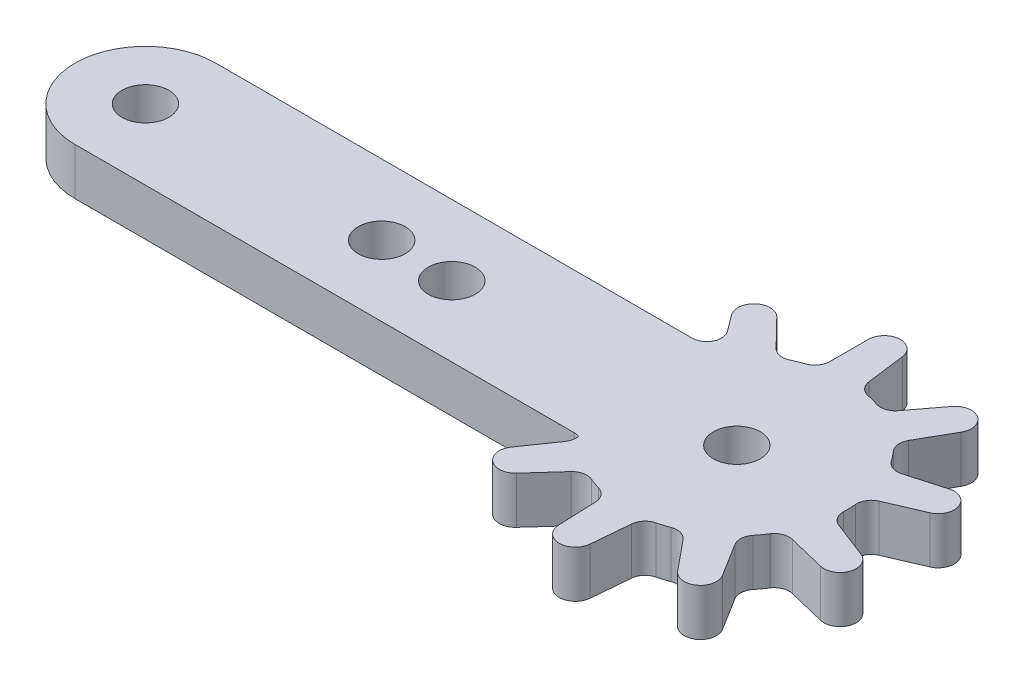
from build123d import *

# Parameters (mm, degrees)
CROQUIS1_R              = 1.5875
SALIENTE_EXTRUIR1_DEPTH = 3.175
SALIENTE_EXTRUIR2_START = -3.175
CROQUIS2_R              = 7.5
CROQUIS2_R_2            = 1.5875
SALIENTE_EXTRUIR2_DEPTH = 3.175
SALIENTE_EXTRUIR3_START = -3.175
SALIENTE_EXTRUIR3_DEPTH = 3.175
CORTAR_EXTRUIR4_START   = -10
CORTAR_EXTRUIR4_DEPTH   = 10
MATRIZC1_COUNT          = 8
MATRIZC1_ANGLE          = 259
REDONDEO1_R             = 1
ESQUISSE1_R             = 1.59
ENL_V_MAT_EXTRU_1_DEPTH = 36.494905734


with BuildPart() as part:
    # Croquis1 → Saliente-Extruir1 (new body)
    with BuildSketch(Plane(origin=(0, 0, 0), x_dir=(1, 0, 0), z_dir=(0, 1, 0))):
        with BuildLine():
            Line((-20, 0), (20, 0))
            ThreePointArc((20, 0), (24.7625, -4.7625), (20, -9.525))
            Line((20, -9.525), (-20, -9.525))
            ThreePointArc((-20, -9.525), (-24.7625, -4.7625), (-20, 0))
        make_face()
        with Locations(Location((-20, -4.7625, 0), (0, 0, 270))):
            Circle(CROQUIS1_R, mode=Mode.SUBTRACT)
        with Locations(Location((20, -4.7625, 0), (0, 0, 270))):
            Circle(CROQUIS1_R, mode=Mode.SUBTRACT)
    extrude(amount=SALIENTE_EXTRUIR1_DEPTH)

    # Croquis2 → Saliente-Extruir2 (add)
    with BuildSketch(Plane(origin=(0, 3.175, 0), x_dir=(1, 0, 0), z_dir=(0, 1, 0)).offset(SALIENTE_EXTRUIR2_START)):
        with Locations((20, -4.7625)):
            Circle(CROQUIS2_R)
        with Locations(Location((20, -4.7625, 0), (0, 0, 270))):
            Circle(CROQUIS2_R_2, mode=Mode.SUBTRACT)
    extrude(amount=SALIENTE_EXTRUIR2_DEPTH)

    # Croquis8 → Saliente-Extruir3 (add)
    with BuildSketch(Plane(origin=(0, 3.175, 0), x_dir=(1, 0, 0), z_dir=(0, 1, 0)).offset(SALIENTE_EXTRUIR3_START)):
        with BuildLine():
            Line((11.607813982, 3.461471902), (14.206158981, 0))
            ThreePointArc((14.206158981, 0), (15.121179891, 0.933736858), (16.184441281, 1.694396442))
            Line((16.184441281, 1.694396442), (13.163387879, 4.793819098))
            ThreePointArc((13.163387879, 4.793819098), (12.356515163, 4.161604411), (11.607813982, 3.461471902))
        make_face()
    saliente_extruir3 = extrude(amount=SALIENTE_EXTRUIR3_DEPTH)

    # Croquis9 → Cortar-Extruir4 (cut)
    with BuildSketch(Plane(origin=(0, 3.175, 0), x_dir=(1, 0, 0), z_dir=(0, 1, 0)).offset(CORTAR_EXTRUIR4_START)):
        with BuildLine():
            ThreePointArc((12.35651523, 4.161604469), (11.974526132, 3.819706546), (11.607813982, 3.461471902))
            Line((11.607813982, 3.461471902), (12.19397403, 2.680599255))
            ThreePointArc((12.19397403, 2.680599255), (11.982381708, 3.453243741), (12.35651523, 4.161604469))
        make_face()
        with BuildLine():
            ThreePointArc((13.163387879, 4.793819098), (12.753054069, 4.486514795), (12.35651523, 4.161604469))
            ThreePointArc((12.35651523, 4.161604469), (13.113956627, 4.422436237), (13.844906618, 4.094621057))
            Line((13.844906618, 4.094621057), (13.163387879, 4.793819098))
        make_face()
    cortar_extruir4 = extrude(amount=CORTAR_EXTRUIR4_DEPTH, mode=Mode.SUBTRACT)

    # MatrizC1: Saliente-Extruir3, Cortar-Extruir4 ×8 about axis
    matrizc1_axis = Axis((20, 0, 4.7625), (0, -1, 0))
    add([saliente_extruir3.rotate(matrizc1_axis, i * MATRIZC1_ANGLE / (MATRIZC1_COUNT - 1)) for i in range(1, MATRIZC1_COUNT)])
    add([cortar_extruir4.rotate(matrizc1_axis, i * MATRIZC1_ANGLE / (MATRIZC1_COUNT - 1)) for i in range(1, MATRIZC1_COUNT)], mode=Mode.SUBTRACT)

    # Redondeo1
    # the kernel refuses this fillet: 1 mm, written as the material it adds along each edge
    with BuildSketch(Plane(origin=(27.395406089, 0, 3.514313802), x_dir=(0.12009264391370789, 0, 0.9927626891044079), z_dir=(0, 1, 0)), Plane(origin=(26.657411119, 0, 8.216320666), x_dir=(-0.501549250802915, 0, 0.8651290938461349), z_dir=(0, 1, 0)), Plane(origin=(23.238283761, 0, 11.527373856), x_dir=(-0.9212027273713431, 0, 0.389082941136718), z_dir=(0, 1, 0)), Plane(origin=(18.515005687, 0, 12.114016299), x_dir=(-0.9698611692594302, 0, -0.243658187555294), z_dir=(0, 1, 0)), Plane(origin=(14.389777858, 0, 9.739990082), x_dir=(-0.6279284118017822, 0, -0.7782711029275668), z_dir=(0, 1, 0)), Plane(origin=(16.184441281, 0, -1.694396442), x_dir=(0.8837864601497757, 0, -0.4678904710035554), z_dir=(0, 1, 0)), Plane(origin=(20.838616598, 0, -2.690467342), x_dir=(0.9874067650142349, 0, 0.15820202402031353), z_dir=(0, 1, 0)), Plane(origin=(25.155056708, 0, -0.685012307), x_dir=(0.6933697506528057, 0, 0.7205819792915072), z_dir=(0, 1, 0))) as redondeo1_piece_1:
        with BuildLine():
            CenterArc((0.748840141, 0.998904162), REDONDEO1_R, 196.368950511, 70.948483307)
            Line((-0.210626698, 0.717082614), (0, 0))
            ThreePointArc((0, 0), (0.351018816, 0.008218784), (0.702037632, 0))
        make_face()
    extrude(amount=3.175)
    with BuildSketch(Plane(origin=(26.522503707, 0, 1.06021079), x_dir=(0.9617717559465732, 0, -0.2738523132336944), z_dir=(0, 1, 0)), Plane(origin=(27.437196341, 0, 5.731061088), x_dir=(0.9329135130884484, 0, 0.36010050971495355), z_dir=(0, 1, 0)), Plane(origin=(25.35671448, 0, 10.011843767), x_dir=(0.5283439627642348, 0, 0.8490304217226758), z_dir=(0, 1, 0)), Plane(origin=(21.11892846, 0, 12.178563585), x_dir=(-0.0890050127232042, 0, 0.9960311780813601), z_dir=(0, 1, 0)), Plane(origin=(16.430517523, 0, 11.358619681), x_dir=(-0.6705090902301596, 0, 0.7419013141373477), z_dir=(0, 1, 0)), Plane(origin=(18.238976871, 0, -2.527822183), x_dir=(0.0018564846529317855, 0, -0.9999982767308818), z_dir=(0, 1, 0)), Plane(origin=(22.981009808, 0, -2.119620351), x_dir=(0.6032966406304949, 0, -0.7975168734289948), z_dir=(0, 1, 0))) as redondeo1_piece_2:
        with BuildLine():
            CenterArc((0.747376131, 1), REDONDEO1_R, 199.051516693, 70.948483307)
            ThreePointArc((-0.197849332, 0.673581828), (-0.091039016, 0.339107144), (0, 0))
            Line((0, 0), (0.747376131, 0))
        make_face()
    extrude(amount=3.175)
    with BuildSketch(Plane(origin=(14.206158981, 3.175, 0), x_dir=(-1, 0, 0), z_dir=(0, -1, 0))) as redondeo1_piece_3:
        with BuildLine():
            CenterArc((REDONDEO1_R * 2.00103600097, REDONDEO1_R), REDONDEO1_R, 143.106368796, 126.893631204)
            Line((REDONDEO1_R * 1.20128460683, REDONDEO1_R * 1.6003313315), (0, 0))
            Line((0, 0), (REDONDEO1_R * 2.00103600097, 0))
        make_face()
    extrude(amount=3.175)
    with BuildSketch(Plane(origin=(14.206158981, 3.175, 9.525), x_dir=(-1, 0, 0), z_dir=(0, -1, 0))) as redondeo1_piece_4:
        with BuildLine():
            CenterArc((0.454646298, -1), REDONDEO1_R, 90, 47.317031956)
            ThreePointArc((-0.280469857, -0.322058824), (-0.137942125, -0.163026135), (0, 0))
            Line((0, 0), (0.454646298, 0))
        make_face()
    extrude(amount=3.175)

    # Esquisse1 → Enlèv. mat.-Extru.1 (cut, through all)
    with BuildSketch(Plane(origin=(0, 3.175, 0), x_dir=(1, 0, 0), z_dir=(0, 1, 0))):
        with Locations(Location((0.72, -4.7625, 0), (0, 0, 270))):
            Circle(ESQUISSE1_R)
        with Locations(Location((-4.02, -4.7625, 0), (0, 0, 270))):
            Circle(ESQUISSE1_R)
    extrude(amount=-ENL_V_MAT_EXTRU_1_DEPTH, mode=Mode.SUBTRACT)


solid = part.part
